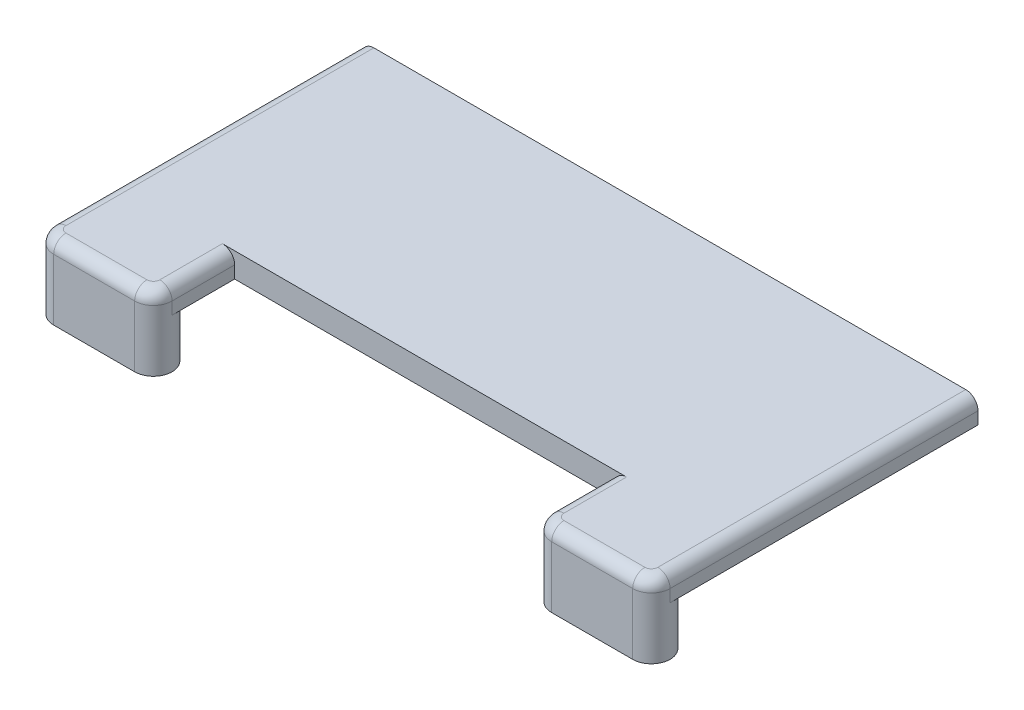
from build123d import *

# Parameters (mm, degrees)
BOSS_EXTRUDE1_DEPTH   = 4
BOSS_EXTRUDE1_2_DEPTH = 4
BOSS_EXTRUDE3_DEPTH   = 2
FILLET2_R             = 1


with BuildPart() as part:
    # Sketch1 → Boss-Extrude1 (new body)
    with BuildSketch(Plane(origin=(0, 0, 0), x_dir=(1, 0, 0), z_dir=(0, 1, 0))):
        with BuildLine():
            Line((-23.6, 10.542278437), (-17, 10.542278437))
            ThreePointArc((-17, 10.542278437), (-15.475, 9.017278437), (-17, 7.492278437))
            Line((-17, 7.492278437), (-23.6, 7.492278437))
            ThreePointArc((-23.6, 7.492278437), (-25.125, 9.017278437), (-23.6, 10.542278437))
        make_face()
    extrude(amount=BOSS_EXTRUDE1_DEPTH)



with BuildPart() as body_2:
    # Sketch1 → Boss-Extrude1 2 (new body)
    with BuildSketch(Plane(origin=(0, 0, 0), x_dir=(1, 0, 0), z_dir=(0, 1, 0))):
        with BuildLine():
            Line((23.6, 7.492278437), (17, 7.492278437))
            ThreePointArc((17, 7.492278437), (15.475, 9.017278437), (17, 10.542278437))
            Line((17, 10.542278437), (23.6, 10.542278437))
            ThreePointArc((23.6, 10.542278437), (25.125, 9.017278437), (23.6, 7.492278437))
        make_face()
    extrude(amount=BOSS_EXTRUDE1_2_DEPTH)


with BuildPart() as part_1:
    add(part.part)

    add(body_2.part)  # Boss-Extrude3 merges body 2
    # Sketch3 → Boss-Extrude3 (add)
    with BuildSketch(Plane(origin=(0, 4, 0), x_dir=(1, 0, 0), z_dir=(0, 1, 0))):
        with BuildLine():
            ThreePointArc((15.475, 9.017278437), (15.921662159, 7.938940596), (17, 7.492278437))
            Line((17, 7.492278437), (23.6, 7.492278437))
            ThreePointArc((23.6, 7.492278437), (24.678337841, 7.938940596), (25.125, 9.017278437))
            Line((25.125, 9.017278437), (25.125, 34.117278437))
            Line((25.125, 34.117278437), (-25.125, 34.117278437))
            Line((-25.125, 34.117278437), (-25.125, 9.017278437))
            ThreePointArc((-25.125, 9.017278437), (-24.678337841, 7.938940596), (-23.6, 7.492278437))
            Line((-23.6, 7.492278437), (-17, 7.492278437))
            ThreePointArc((-17, 7.492278437), (-15.921662159, 7.938940596), (-15.475, 9.017278437))
            Line((-15.475, 9.017278437), (-15.475, 14.117278437))
            Line((-15.475, 14.117278437), (15.475, 14.117278437))
            Line((15.475, 14.117278437), (15.475, 9.017278437))
        make_face()
    extrude(amount=BOSS_EXTRUDE3_DEPTH)

    # Fillet2
    fillet2_edges = [part_1.edges().sort_by_distance(p)[0] for p in [
        (-25.125, 6, -21.567278437),
        (-24.678337841, 6, -7.938940596),
        (-15.475, 6, -11.567278437),
        (-15.921662159, 6, -7.938940596),
        (15.475, 6, -11.567278437),
        (15.921662159, 6, -7.938940596),
        (25.125, 6, -21.567278437),
        (24.678337841, 6, -7.938940596),
        (-20.3, 6, -7.492278437),
        (20.3, 6, -7.492278437),
    ]]
    fillet(fillet2_edges, radius=FILLET2_R)


solid = part_1.part
